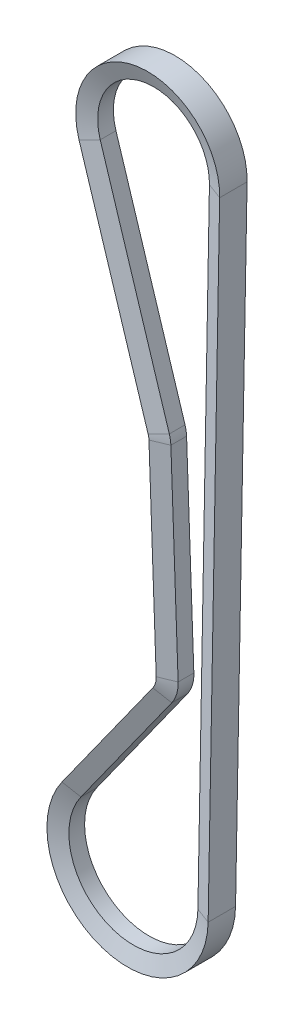
from build123d import *


with BuildPart() as part:
    # Sweep1: sweep along a path in Sketch2
    with BuildLine(Plane.XY) as sweep1_path:
        Line((24.995862362, -0.454823909), (20.993784106, -220.397960582))
        ThreePointArc((20.993784106, -220.397960582), (-15.799319561, -246.470502978), (-29.773179159, -203.595787907))
        Line((-29.773179159, -203.595787907), (1.773202965, -159.504972266))
        ThreePointArc((1.773202965, -159.504972266), (2.689198387, -157.641079924), (2.954810953, -155.581324542))
        Line((2.954810953, -155.581324542), (0.433926136, -85.626731127))
        ThreePointArc((0.433926136, -85.626731127), (0.346435523, -84.780678824), (0.146657985, -83.953909182))
        Line((0.146657985, -83.953909182), (-23.85280639, -7.486229178))
        ThreePointArc((-23.85280639, -7.486229178), (-3.561854749, 24.744962937), (24.995862362, -0.454823909))
    # Sketch3 → Sweep1 (sweep)
    with BuildSketch(Plane(origin=(-23.85280639, -7.486229178, 0), x_dir=(0.9541122556131011, 0.29944916712003167, 0), z_dir=(-0.29944916712003167, 0.9541122556131011, 0))):
        Polygon((0, -4.7625), (0, 4.7625), (5.588, 2.728634331), (5.588, -2.728634331), align=None)
    sweep(path=sweep1_path.line)


solid = part.part
